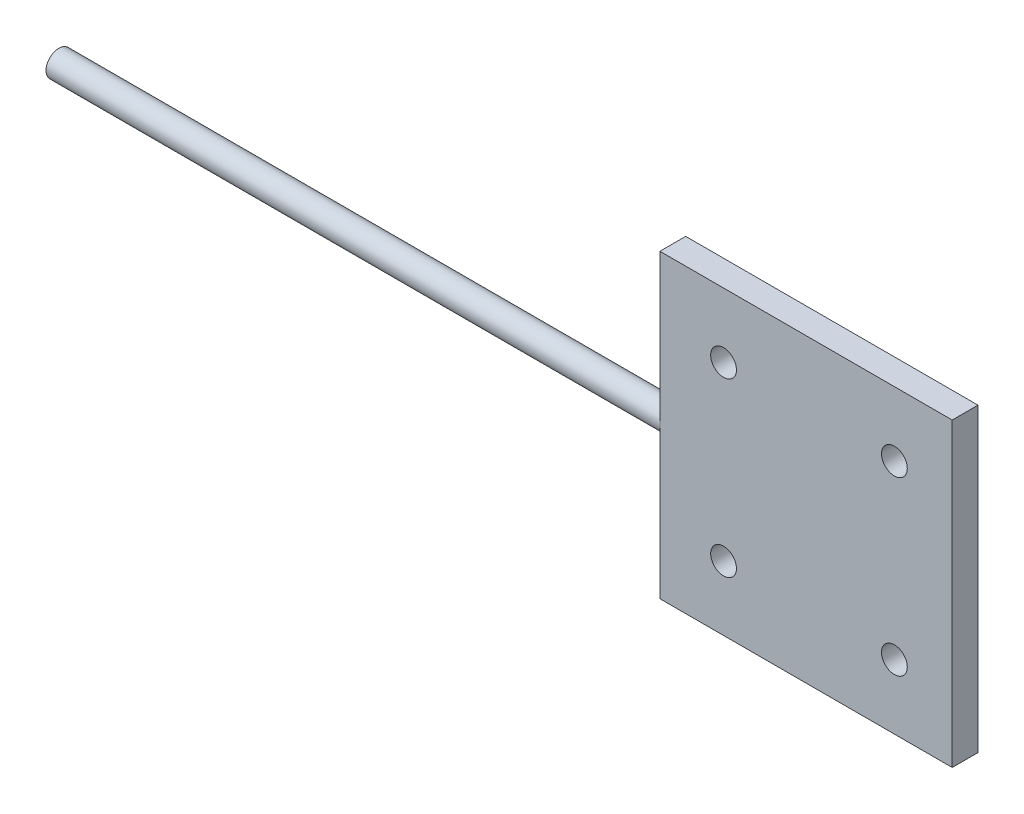
from build123d import *

# Parameters (mm, degrees)
SKETCH_1_W          = 34
SKETCH_1_H          = 35
EXTRUDE_1_DEPTH     = 3
SKETCH_7_R          = 1.5
CUT_EXTRUDE_1_DEPTH = 10
SKETCH_8_R          = 1.5
EXTRUDE_2_DEPTH     = 71.4


with BuildPart() as part:
    # 草图1 → 凸台-拉伸1 (new body)
    with BuildSketch(Plane.XY):
        Rectangle(SKETCH_1_W, SKETCH_1_H)
    extrude(amount=EXTRUDE_1_DEPTH)

    # 草图7 → 切除-拉伸1 (cut)
    with BuildSketch(Plane.XY.offset(3)):
        with Locations((10.27515824, 10)):
            Circle(SKETCH_7_R)
        with Locations((10.27515824, -10)):
            Circle(SKETCH_7_R)
        with Locations((-9.593631375, 10)):
            Circle(SKETCH_7_R)
        with Locations((-9.593631375, -10)):
            Circle(SKETCH_7_R)
    extrude(amount=-CUT_EXTRUDE_1_DEPTH, mode=Mode.SUBTRACT)

    # 草图8 → 凸台-拉伸2 (add)
    with BuildSketch(Plane.ZY.offset(17)):
        with Locations((1.5, 0)):
            Circle(SKETCH_8_R)
    extrude(amount=EXTRUDE_2_DEPTH)


solid = part.part
